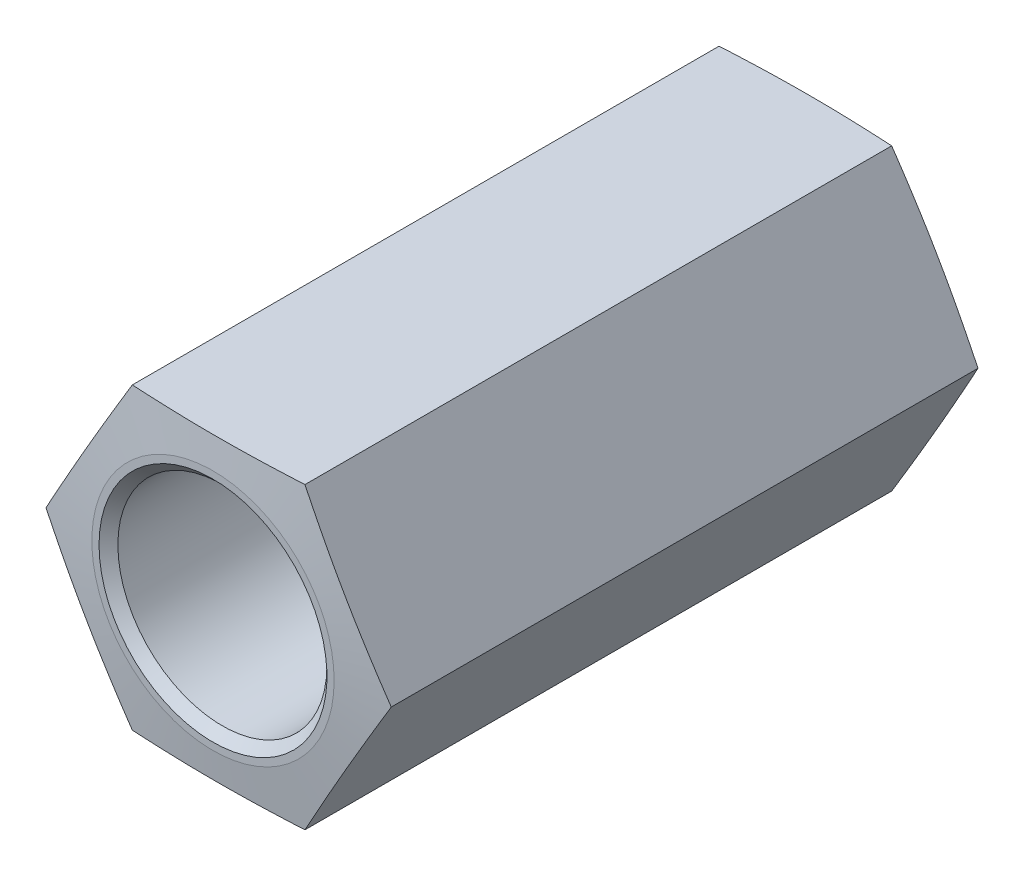
from build123d import *

# Parameters (mm, degrees)
SKETCH1_R      = 2.220000009
EXTRUDE1_DEPTH = 6.35
CHAMFER1_SIZE  = 0.2


with BuildPart() as part:
    # Sketch1 → Extrude1 (new, symmetric)
    with BuildSketch(Plane.XY):
        Polygon((-3.666174209, -6.3e-08), (-1.833087105, -3.175000063), (1.833087105, -3.174999937), (3.666174209, 6.3e-08), (1.833087105, 3.175000063), (-1.833087105, 3.174999937), align=None)
        with Locations((0, -6.3e-08)):
            Circle(SKETCH1_R, mode=Mode.SUBTRACT)
    extrude(amount=EXTRUDE1_DEPTH, both=True)

    # Chamfer1
    chamfer1_edges = [part.edges().sort_by_distance(p)[0] for p in [
        (-2.220000009, -6.3e-08, -6.35),
        (-2.220000009, -6.3e-08, 6.35),
    ]]
    chamfer(chamfer1_edges, length=CHAMFER1_SIZE)

    # Sketch2 → Cut-Revolve1 (revolve, cut)
    with BuildSketch(Plane.XZ):
        Polygon((-2.572739255, -6.35), (-3.666174209, -6.23), (-3.666174209, -6.35), align=None)
    cut_revolve1 = revolve(axis=Axis((0, -6.3e-08, 6.35), (0, 0, -1)), mode=Mode.SUBTRACT)

    # Mirror1: Cut-Revolve1 across plane
    add(cut_revolve1.mirror(Plane.XY), mode=Mode.SUBTRACT)


solid = part.part
